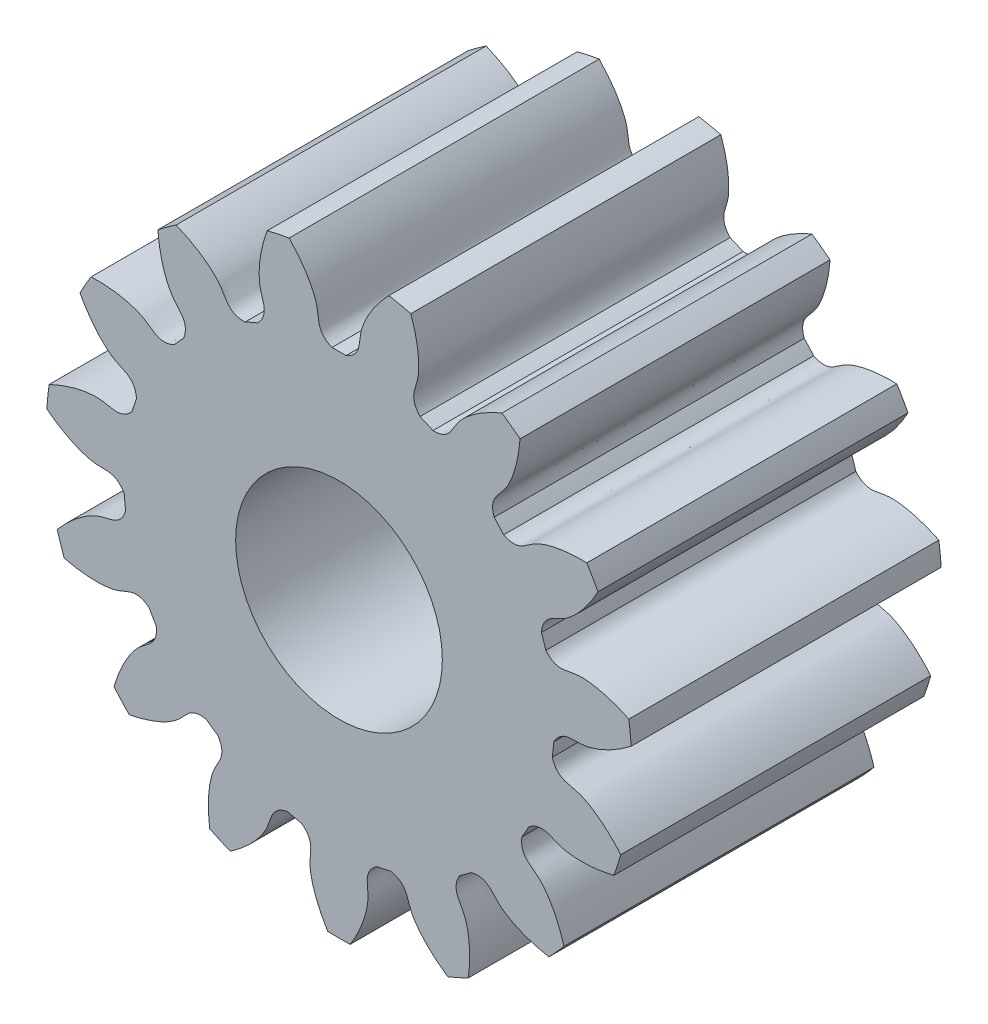
from build123d import *

# Parameters (mm, degrees)
SKETCH_1_R               = 4.25
EXTRUDE_1_DEPTH          = 4.5
CUT_EXTRUDE_1_DEPTH      = 8.508328709
PATTERN_CIRCULAR_1_COUNT = 15
CUT_EXTRUDE_2_REACH      = 9.503
SKETCH_4_R               = 1.5


with BuildPart() as part:
    # 草图1 → 凸台-拉伸1 (new body)
    with BuildSketch(Plane.XY):
        Circle(SKETCH_1_R)
    extrude(amount=EXTRUDE_1_DEPTH)

    # 草图2 → 切除-拉伸1 (cut, through all)
    with BuildSketch(Plane.XY):
        with BuildLine():
            ThreePointArc((0.102142521, 3.123330259), (0, 3.125), (-0.102142521, 3.123330259))
            add(Edge.make_bspline(
                [(-0.102142521, 3.123330259), (-0.328606529, 3.217205114), (-0.286056567, 3.393164711), (-0.325630243, 3.554251883), (-0.328716589, 3.565829148), (-0.332424424, 3.578696912), (-0.336805119, 3.592834652), (-0.341911201, 3.608219988), (-0.347794015, 3.624829049), (-0.354504401, 3.642636383), (-0.362092429, 3.661615009), (-0.370607425, 3.68173642), (-0.380097912, 3.702970613), (-0.390611575, 3.725286105), (-0.402195217, 3.748649954), (-0.414894726, 3.773027785), (-0.42875503, 3.798383812), (-0.443820065, 3.824680861), (-0.460132732, 3.851880399), (-0.477734865, 3.87994256), (-0.496667191, 3.908826169), (-0.516969298, 3.938488777), (-0.538679598, 3.968886682), (-0.561835294, 3.999974966), (-0.586472345, 4.031707525), (-0.612625439, 4.064037097), (-0.640327952, 4.096915299), (-0.669611928, 4.130292659), (-0.70050804, 4.164118648), (-0.733045564, 4.198341721), (-0.767252353, 4.232909346), (-0.803154806, 4.267768045), (-0.840777842, 4.30286343), (-0.880144878, 4.33814024), (-0.921277797, 4.373542382), (-0.964196933, 4.409012967), (-1.008921041, 4.444494353), (-1.055467278, 4.479928182), (-1.103851182, 4.515255425), (-1.154086653, 4.550416421), (-1.206185932, 4.585350919), (-1.260159587, 4.619998121), (-1.316016488, 4.654296726), (-1.373763805, 4.688184973), (-1.433406971, 4.721600685), (-1.516292831, 4.765884352), (-1.580075957, 4.797516983), (-1.623419194, 4.817964103)],
                knots=[0, 0, 0, 0, 0.202473101, 0.206978902, 0.212085478, 0.217792827, 0.224100949, 0.231009845, 0.238519514, 0.246629958, 0.255341174, 0.264653164, 0.274565928, 0.285079465, 0.296193776, 0.307908861, 0.320224719, 0.33314135, 0.346658755, 0.360776934, 0.375495886, 0.390815612, 0.406736111, 0.423257384, 0.440379431, 0.458102251, 0.476425844, 0.495350211, 0.514875352, 0.535001266, 0.555727954, 0.577055415, 0.59898365, 0.621512658, 0.64464244, 0.668372996, 0.692704325, 0.717636428, 0.743169304, 0.769302954, 0.796037377, 0.823372574, 0.851308544, 0.879845288, 0.908982806, 0.938721097, 1, 1, 1, 1], degree=3))
            ThreePointArc((-1.623419194, 4.817964103), (0, 5.084119194), (1.623419194, 4.817964103))
            add(Edge.make_bspline(
                [(0.102142521, 3.123330259), (0.328606529, 3.217205114), (0.286056567, 3.393164711), (0.325630243, 3.554251883), (0.328716589, 3.565829148), (0.332424424, 3.578696912), (0.336805119, 3.592834652), (0.341911201, 3.608219988), (0.347794015, 3.624829049), (0.354504401, 3.642636383), (0.362092429, 3.661615009), (0.370607425, 3.68173642), (0.380097912, 3.702970613), (0.390611575, 3.725286105), (0.402195217, 3.748649954), (0.414894726, 3.773027785), (0.42875503, 3.798383812), (0.443820065, 3.824680861), (0.460132732, 3.851880399), (0.477734865, 3.87994256), (0.496667191, 3.908826169), (0.516969298, 3.938488777), (0.538679598, 3.968886682), (0.561835294, 3.999974966), (0.586472345, 4.031707525), (0.612625439, 4.064037097), (0.640327952, 4.096915299), (0.669611928, 4.130292659), (0.70050804, 4.164118648), (0.733045564, 4.198341721), (0.767252353, 4.232909346), (0.803154806, 4.267768045), (0.840777842, 4.30286343), (0.880144878, 4.33814024), (0.921277797, 4.373542382), (0.964196933, 4.409012967), (1.008921041, 4.444494353), (1.055467278, 4.479928182), (1.103851182, 4.515255425), (1.154086653, 4.550416421), (1.206185932, 4.585350919), (1.260159587, 4.619998121), (1.316016488, 4.654296726), (1.373763805, 4.688184973), (1.433406971, 4.721600685), (1.516292831, 4.765884352), (1.580075957, 4.797516983), (1.623419194, 4.817964103)],
                knots=[0, 0, 0, 0, 0.202473101, 0.206978902, 0.212085478, 0.217792827, 0.224100949, 0.231009845, 0.238519514, 0.246629958, 0.255341174, 0.264653164, 0.274565928, 0.285079465, 0.296193776, 0.307908861, 0.320224719, 0.33314135, 0.346658755, 0.360776934, 0.375495886, 0.390815612, 0.406736111, 0.423257384, 0.440379431, 0.458102251, 0.476425844, 0.495350211, 0.514875352, 0.535001266, 0.555727954, 0.577055415, 0.59898365, 0.621512658, 0.64464244, 0.668372996, 0.692704325, 0.717636428, 0.743169304, 0.769302954, 0.796037377, 0.823372574, 0.851308544, 0.879845288, 0.908982806, 0.938721097, 1, 1, 1, 1], degree=3))
        make_face()
    cut_extrude_1 = extrude(amount=CUT_EXTRUDE_1_DEPTH, mode=Mode.SUBTRACT)

    # 阵列(圆周)1: 切除-拉伸1 ×15 about axis
    pattern_circular_1_axis = Axis((0, 0, 4.5), (0, 0, -1))
    for i in range(1, PATTERN_CIRCULAR_1_COUNT):
        add(cut_extrude_1.rotate(pattern_circular_1_axis, i * 360 / PATTERN_CIRCULAR_1_COUNT), mode=Mode.SUBTRACT)

    # 草图4 → 切除-拉伸2 (cut, up to next)
    with BuildSketch(Plane.XY.offset(4.5), mode=Mode.PRIVATE) as cut_extrude_2_sk1:
        Circle(SKETCH_4_R)
    cut_extrude_2_tool1 = extrude(cut_extrude_2_sk1.sketch, amount=-CUT_EXTRUDE_2_REACH, mode=Mode.PRIVATE) & part.part
    add(cut_extrude_2_tool1.solids().sort_by_distance((0, 0, 4.5))[0], mode=Mode.SUBTRACT)


solid = part.part
